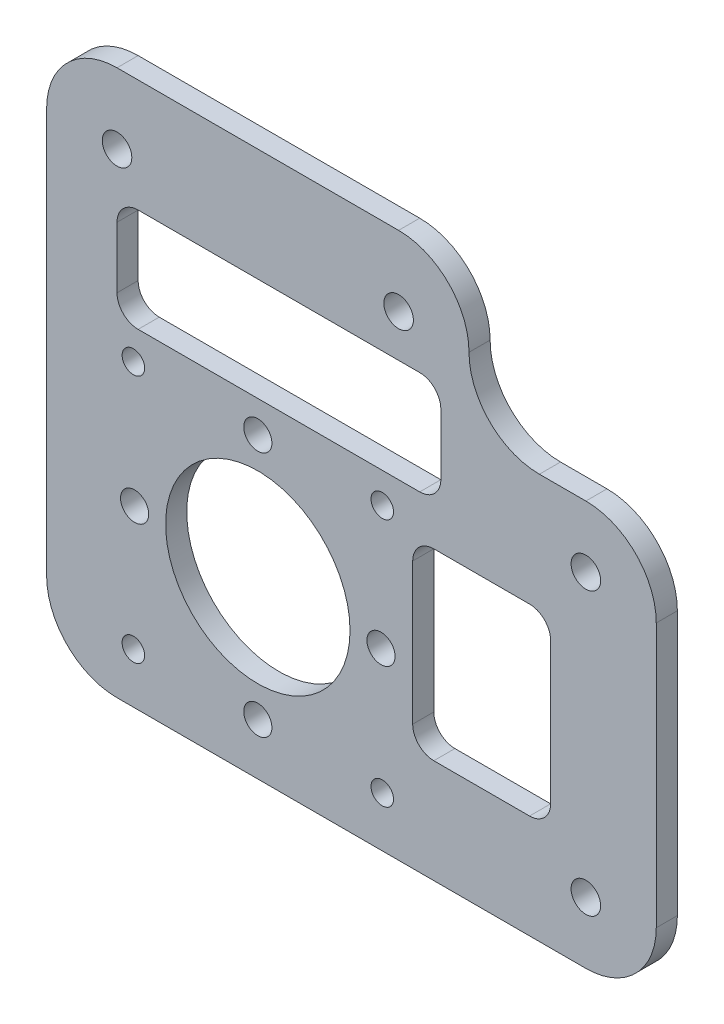
from build123d import *

# Parameters (mm, degrees)
SKETCH_1_R          = 1.6
SKETCH_1_R_2        = 2
SKETCH_1_R_3        = 13.1
EXTRUDE_1_DEPTH     = 3
SKETCH_2_R          = 2.1
CUT_EXTRUDE_1_DEPTH = 117.253215009
FILLET_1_R          = 10
SKETCH_4_W          = 19.6
SKETCH_4_H          = 26.07233047
SKETCH_4_W_2        = 46
SKETCH_4_H_2        = 14.67766953
CUT_EXTRUDE_2_DEPTH = 117.253215009
FILLET_2_R          = 3


with BuildPart() as part:
    # 草图1 → 凸台-拉伸1 (new body)
    with BuildSketch(Plane.XY):
        Polygon((0, 0), (0, 77.5), (60, 77.5), (60, 57.5), (86.6, 57.5), (86.6, 0), align=None)
        with Locations((12.32233047, 42.5)):
            Circle(SKETCH_1_R, mode=Mode.SUBTRACT)
        with Locations((30, 42.32233047)):
            Circle(SKETCH_1_R_2, mode=Mode.SUBTRACT)
        with Locations((30, 24.82233047)):
            Circle(SKETCH_1_R_3, mode=Mode.SUBTRACT)
        with Locations((12.5, 24.82233047)):
            Circle(SKETCH_1_R_2, mode=Mode.SUBTRACT)
        with Locations((12.32233047, 7.144660941)):
            Circle(SKETCH_1_R, mode=Mode.SUBTRACT)
        with Locations((30, 7.32233047)):
            Circle(SKETCH_1_R_2, mode=Mode.SUBTRACT)
        with Locations((47.67766953, 7.144660941)):
            Circle(SKETCH_1_R, mode=Mode.SUBTRACT)
        with Locations((47.5, 24.82233047)):
            Circle(SKETCH_1_R_2, mode=Mode.SUBTRACT)
        with Locations((47.67766953, 42.5)):
            Circle(SKETCH_1_R, mode=Mode.SUBTRACT)
    extrude(amount=EXTRUDE_1_DEPTH)

    # 草图2 → 切除-拉伸1 (cut, through all)
    with BuildSketch(Plane.XY.offset(3)):
        with Locations((10, 67.5)):
            Circle(SKETCH_2_R)
        with Locations((50, 67.5)):
            Circle(SKETCH_2_R)
        with Locations((76.6, 48.75)):
            Circle(SKETCH_2_R)
        with Locations((76.6, 8.75)):
            Circle(SKETCH_2_R)
    extrude(amount=-CUT_EXTRUDE_1_DEPTH, mode=Mode.SUBTRACT)

    # 圆角1
    fillet_1_edges = [part.edges().sort_by_distance(p)[0] for p in [
        (0, 77.5, 1.5),
        (0, 0, 1.5),
        (86.6, 0, 1.5),
        (86.6, 57.5, 1.5),
        (60, 77.5, 1.5),
        (60, 57.5, 1.5),
    ]]
    fillet(fillet_1_edges, radius=FILLET_1_R - 0.0001)  # a hair under: the kernel refuses the full size

    # 草图4 → 切除-拉伸2 (cut, through all)
    with BuildSketch(Plane.XY.offset(3)):
        with Locations((61.8, 27.786165235)):
            Rectangle(SKETCH_4_W, SKETCH_4_H)
        with Locations((33, 54.161165235)):
            Rectangle(SKETCH_4_W_2, SKETCH_4_H_2)
    extrude(amount=-CUT_EXTRUDE_2_DEPTH, mode=Mode.SUBTRACT)

    # 圆角2
    fillet_2_edges = [part.edges().sort_by_distance(p)[0] for p in [
        (56, 46.82233047, 1.5),
        (10, 46.82233047, 1.5),
        (10, 61.5, 1.5),
        (56, 61.5, 1.5),
        (52, 14.75, 1.5),
        (52, 40.82233047, 1.5),
        (71.6, 40.82233047, 1.5),
        (71.6, 14.75, 1.5),
    ]]
    fillet(fillet_2_edges, radius=FILLET_2_R)


solid = part.part
